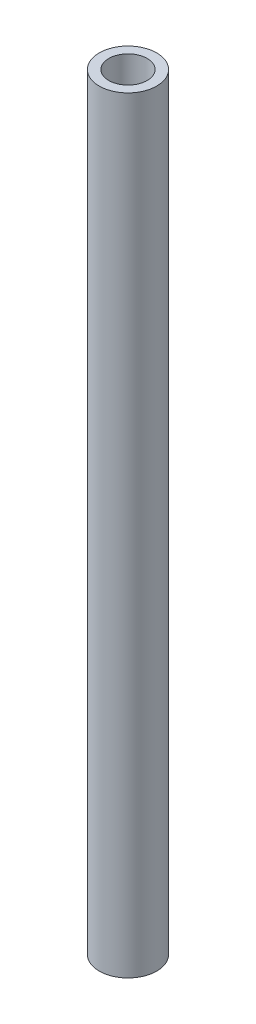
from build123d import *

# Parameters (mm, degrees)
SKETCH1_R           = 4.7625
SKETCH1_R_2         = 3.175
BOSS_EXTRUDE1_DEPTH = 127


with BuildPart() as part:
    # Sketch1 → Boss-Extrude1 (new body)
    with BuildSketch(Plane(origin=(0, 0, 0), x_dir=(1, 0, 0), z_dir=(0, 1, 0))):
        Circle(SKETCH1_R)
        Circle(SKETCH1_R_2, mode=Mode.SUBTRACT)
    extrude(amount=BOSS_EXTRUDE1_DEPTH)


solid = part.part
